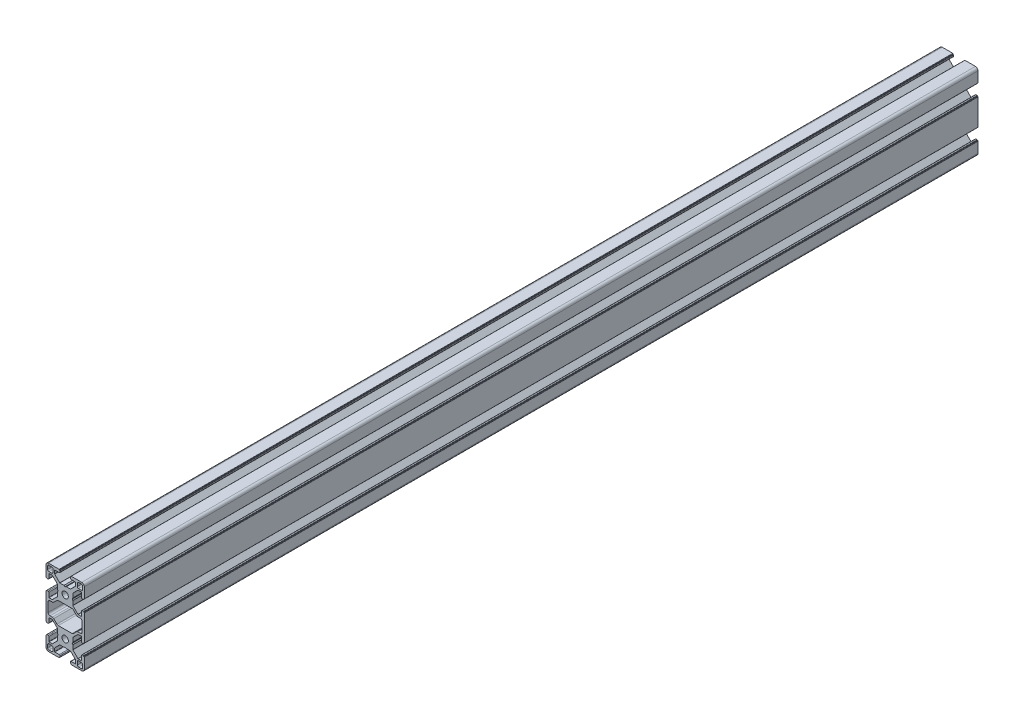
from build123d import *

# Parameters (mm, degrees)
SKETCH1_R                 = 2.45
BOSS_EXTRUDE1_DEPTH       = 700
SKETCH2_R                 = 3
CUT_EXTRUDE1_DEPTH        = 678.163200418
SKETCH3_R                 = 3
CUT_EXTRUDE2_DEPTH        = 678.827411761
M6X1_0_TAPPED_HOLE1_D     = 5
M6X1_0_TAPPED_HOLE1_DEPTH = 28
M6X1_0_TAPPED_HOLE1_TIP   = 1.502151548
M6X1_0_TAPPED_HOLE2_D     = 5
M6X1_0_TAPPED_HOLE2_DEPTH = 28
M6X1_0_TAPPED_HOLE2_TIP   = 1.502151548


with BuildPart() as part:
    # Sketch1 → Boss-Extrude1 (new body)
    with BuildSketch(Plane.XY.offset(25)):
        with BuildLine():
            Line((13.400000821, -25.95), (14.300000334, -25.95))
            ThreePointArc((14.300000334, -25.95), (14.44142169, -25.891421356), (14.500000334, -25.75))
            Line((14.500000334, -25.75), (14.500000334, -25.65))
            ThreePointArc((14.500000334, -25.65), (14.558578978, -25.508578644), (14.700000334, -25.45))
            Line((14.700000334, -25.45), (14.8, -25.45))
            ThreePointArc((14.8, -25.45), (14.941421356, -25.391421356), (15, -25.25))
            Line((15, -25.25), (15, -4.75))
            ThreePointArc((15, -4.75), (14.941421356, -4.608578644), (14.8, -4.55))
            Line((14.8, -4.55), (14.700000334, -4.55))
            ThreePointArc((14.700000334, -4.55), (14.558578978, -4.491421356), (14.500000334, -4.35))
            Line((14.500000334, -4.35), (14.500000334, -4.25))
            ThreePointArc((14.500000334, -4.25), (14.44142169, -4.108578644), (14.300000334, -4.05))
            Line((14.300000334, -4.05), (13.400000821, -4.05))
            ThreePointArc((13.400000821, -4.05), (12.975736752, -4.225735931), (12.800000821, -4.65))
            Line((12.800000821, -4.65), (12.800000821, -8.05))
            ThreePointArc((12.800000821, -8.05), (12.741422177, -8.191421356), (12.600000821, -8.25))
            Line((12.600000821, -8.25), (10.132847586, -8.25))
            ThreePointArc((10.132847586, -8.25), (10.056310912, -8.234775911), (9.991426248, -8.191421374))
            Line((9.991426248, -8.191421374), (6.06304592, -4.263042046))
            ThreePointArc((6.06304592, -4.263042046), (6.019691356, -4.19815737), (6.004467258, -4.121620672))
            Line((6.004467258, -4.121620672), (6.004467258, -0.90000009))
            Line((6.004467258, -0.90000009), (5.542586948, -0.099999736))
            ThreePointArc((5.542586948, -0.099999736), (5.515792105, 0), (5.542586948, 0.099999736))
            Line((5.542586948, 0.099999736), (6.004467258, 0.90000009))
            Line((6.004467258, 0.90000009), (6.004467258, 4.121623437))
            ThreePointArc((6.004467258, 4.121623437), (6.019691347, 4.198160112), (6.063045884, 4.263044775))
            Line((6.063045884, 4.263044775), (9.991421447, 8.191421338))
            ThreePointArc((9.991421447, 8.191421338), (10.056306123, 8.234775902), (10.132842821, 8.25))
            Line((10.132842821, 8.25), (12.600000821, 8.25))
            ThreePointArc((12.600000821, 8.25), (12.741422177, 8.191421356), (12.800000821, 8.05))
            Line((12.800000821, 8.05), (12.800000821, 4.65))
            ThreePointArc((12.800000821, 4.65), (12.975736752, 4.225735931), (13.400000821, 4.05))
            Line((13.400000821, 4.05), (14.300000334, 4.05))
            ThreePointArc((14.300000334, 4.05), (14.44142169, 4.108578644), (14.500000334, 4.25))
            Line((14.500000334, 4.25), (14.500000334, 4.350000125))
            ThreePointArc((14.500000334, 4.350000125), (14.558578978, 4.491421481), (14.700000334, 4.550000125))
            Line((14.700000334, 4.550000125), (14.8, 4.550000125))
            ThreePointArc((14.8, 4.550000125), (14.941421356, 4.608578769), (15, 4.750000125))
            Line((15, 4.750000125), (15, 13))
            ThreePointArc((15, 13), (14.414213562, 14.414213562), (13, 15))
            Line((13, 15), (4.75, 15))
            ThreePointArc((4.75, 15), (4.608578644, 14.941421356), (4.55, 14.8))
            Line((4.55, 14.8), (4.55, 14.7))
            ThreePointArc((4.55, 14.7), (4.491421356, 14.558578644), (4.35, 14.5))
            Line((4.35, 14.5), (4.25, 14.5))
            ThreePointArc((4.25, 14.5), (4.108578644, 14.441421356), (4.05, 14.3))
            Line((4.05, 14.3), (4.05, 13.4))
            ThreePointArc((4.05, 13.4), (4.225735931, 12.975735931), (4.65, 12.8))
            Line((4.65, 12.8), (8.05, 12.8))
            ThreePointArc((8.05, 12.8), (8.191421356, 12.741421356), (8.25, 12.6))
            Line((8.25, 12.6), (8.25, 10.132847492))
            ThreePointArc((8.25, 10.132847492), (8.234775904, 10.056310778), (8.191421344, 9.991426082))
            Line((8.191421344, 9.991426082), (4.258574852, 6.058578588))
            ThreePointArc((4.258574852, 6.058578588), (4.193690258, 6.015224079), (4.117153656, 6))
            Line((4.117153656, 6), (0.899999648, 6))
            Line((0.899999648, 6), (0.101934004, 5.53923672))
            ThreePointArc((0.101934004, 5.53923672), (0, 5.511923593), (-0.101934004, 5.53923672))
            Line((-0.101934004, 5.53923672), (-0.899999648, 6))
            Line((-0.899999648, 6), (-4.117156145, 6))
            ThreePointArc((-4.117156145, 6), (-4.193692724, 6.015224069), (-4.258577305, 6.058578552))
            Line((-4.258577305, 6.058578552), (-8.191421308, 9.991421554))
            ThreePointArc((-8.191421308, 9.991421554), (-8.234775894, 10.056306263), (-8.25, 10.132843))
            Line((-8.25, 10.132843), (-8.25, 12.6))
            ThreePointArc((-8.25, 12.6), (-8.191421356, 12.741421356), (-8.05, 12.8))
            Line((-8.05, 12.8), (-4.65, 12.8))
            ThreePointArc((-4.65, 12.8), (-4.225735931, 12.975735931), (-4.05, 13.4))
            Line((-4.05, 13.4), (-4.05, 14.3))
            ThreePointArc((-4.05, 14.3), (-4.108578644, 14.441421356), (-4.25, 14.5))
            Line((-4.25, 14.5), (-4.35, 14.5))
            ThreePointArc((-4.35, 14.5), (-4.491421356, 14.558578644), (-4.55, 14.7))
            Line((-4.55, 14.7), (-4.55, 14.8))
            ThreePointArc((-4.55, 14.8), (-4.608578644, 14.941421356), (-4.75, 15))
            Line((-4.75, 15), (-13, 15))
            ThreePointArc((-13, 15), (-14.414213562, 14.414213562), (-15, 13))
            Line((-15, 13), (-15, 4.750000125))
            ThreePointArc((-15, 4.750000125), (-14.941421356, 4.608578769), (-14.8, 4.550000125))
            Line((-14.8, 4.550000125), (-14.700000334, 4.550000125))
            ThreePointArc((-14.700000334, 4.550000125), (-14.558578978, 4.491421481), (-14.500000334, 4.350000125))
            Line((-14.500000334, 4.350000125), (-14.500000334, 4.25))
            ThreePointArc((-14.500000334, 4.25), (-14.44142169, 4.108578644), (-14.300000334, 4.05))
            Line((-14.300000334, 4.05), (-13.400000821, 4.05))
            ThreePointArc((-13.400000821, 4.05), (-12.975736752, 4.225735931), (-12.800000821, 4.65))
            Line((-12.800000821, 4.65), (-12.800000821, 8.05))
            ThreePointArc((-12.800000821, 8.05), (-12.741422177, 8.191421356), (-12.600000821, 8.25))
            Line((-12.600000821, 8.25), (-10.132842821, 8.25))
            ThreePointArc((-10.132842821, 8.25), (-10.056306123, 8.234775902), (-9.991421447, 8.191421338))
            Line((-9.991421447, 8.191421338), (-6.063045884, 4.263044775))
            ThreePointArc((-6.063045884, 4.263044775), (-6.019691347, 4.198160112), (-6.004467258, 4.121623437))
            Line((-6.004467258, 4.121623437), (-6.004467258, 0.90000009))
            Line((-6.004467258, 0.90000009), (-5.542586948, 0.099999736))
            ThreePointArc((-5.542586948, 0.099999736), (-5.515792105, 0), (-5.542586948, -0.099999736))
            Line((-5.542586948, -0.099999736), (-6.004467258, -0.90000009))
            Line((-6.004467258, -0.90000009), (-6.004467258, -4.121623437))
            ThreePointArc((-6.004467258, -4.121623437), (-6.019691347, -4.198160112), (-6.063045884, -4.263044775))
            Line((-6.063045884, -4.263044775), (-9.991421447, -8.191421338))
            ThreePointArc((-9.991421447, -8.191421338), (-10.056306123, -8.234775902), (-10.132842821, -8.25))
            Line((-10.132842821, -8.25), (-12.600000821, -8.25))
            ThreePointArc((-12.600000821, -8.25), (-12.741422177, -8.191421356), (-12.800000821, -8.05))
            Line((-12.800000821, -8.05), (-12.800000821, -4.65))
            ThreePointArc((-12.800000821, -4.65), (-12.975736752, -4.225735931), (-13.400000821, -4.05))
            Line((-13.400000821, -4.05), (-14.300000334, -4.05))
            ThreePointArc((-14.300000334, -4.05), (-14.44142169, -4.108578644), (-14.500000334, -4.25))
            Line((-14.500000334, -4.25), (-14.500000334, -4.35))
            ThreePointArc((-14.500000334, -4.35), (-14.558578978, -4.491421356), (-14.700000334, -4.55))
            Line((-14.700000334, -4.55), (-14.8, -4.55))
            ThreePointArc((-14.8, -4.55), (-14.941421356, -4.608578644), (-15, -4.75))
            Line((-15, -4.75), (-15, -25.25))
            ThreePointArc((-15, -25.25), (-14.941421356, -25.391421356), (-14.8, -25.45))
            Line((-14.8, -25.45), (-14.700000334, -25.45))
            ThreePointArc((-14.700000334, -25.45), (-14.558578978, -25.508578644), (-14.500000334, -25.65))
            Line((-14.500000334, -25.65), (-14.500000334, -25.75))
            ThreePointArc((-14.500000334, -25.75), (-14.44142169, -25.891421356), (-14.300000334, -25.95))
            Line((-14.300000334, -25.95), (-13.400000821, -25.95))
            ThreePointArc((-13.400000821, -25.95), (-12.975736752, -25.774264069), (-12.800000821, -25.35))
            Line((-12.800000821, -25.35), (-12.800000821, -21.95))
            ThreePointArc((-12.800000821, -21.95), (-12.741422177, -21.808578644), (-12.600000821, -21.75))
            Line((-12.600000821, -21.75), (-10.132842821, -21.75))
            ThreePointArc((-10.132842821, -21.75), (-10.056306123, -21.765224098), (-9.991421447, -21.808578662))
            Line((-9.991421447, -21.808578662), (-6.063045884, -25.736955225))
            ThreePointArc((-6.063045884, -25.736955225), (-6.019691347, -25.801839888), (-6.004467258, -25.878376563))
            Line((-6.004467258, -25.878376563), (-6.004467258, -29.09999991))
            Line((-6.004467258, -29.09999991), (-5.542586948, -29.900000264))
            ThreePointArc((-5.542586948, -29.900000264), (-5.515792105, -30), (-5.542586948, -30.099999736))
            Line((-5.542586948, -30.099999736), (-6.004467258, -30.90000009))
            Line((-6.004467258, -30.90000009), (-6.004467258, -34.121623437))
            ThreePointArc((-6.004467258, -34.121623437), (-6.019691347, -34.198160112), (-6.063045884, -34.263044775))
            Line((-6.063045884, -34.263044775), (-9.991421447, -38.191421338))
            ThreePointArc((-9.991421447, -38.191421338), (-10.056306123, -38.234775902), (-10.132842821, -38.25))
            Line((-10.132842821, -38.25), (-12.600000821, -38.25))
            ThreePointArc((-12.600000821, -38.25), (-12.741422177, -38.191421356), (-12.800000821, -38.05))
            Line((-12.800000821, -38.05), (-12.800000821, -34.65))
            ThreePointArc((-12.800000821, -34.65), (-12.975736752, -34.225735931), (-13.400000821, -34.05))
            Line((-13.400000821, -34.05), (-14.300000334, -34.05))
            ThreePointArc((-14.300000334, -34.05), (-14.44142169, -34.108578644), (-14.500000334, -34.25))
            Line((-14.500000334, -34.25), (-14.500000334, -34.350000125))
            ThreePointArc((-14.500000334, -34.350000125), (-14.558578978, -34.491421481), (-14.700000334, -34.550000125))
            Line((-14.700000334, -34.550000125), (-14.8, -34.550000125))
            ThreePointArc((-14.8, -34.550000125), (-14.941421356, -34.608578769), (-15, -34.750000125))
            Line((-15, -34.750000125), (-15, -43))
            ThreePointArc((-15, -43), (-14.414213562, -44.414213562), (-13, -45))
            Line((-13, -45), (-4.75, -45))
            ThreePointArc((-4.75, -45), (-4.608578644, -44.941421356), (-4.55, -44.8))
            Line((-4.55, -44.8), (-4.55, -44.7))
            ThreePointArc((-4.55, -44.7), (-4.491421356, -44.558578644), (-4.35, -44.5))
            Line((-4.35, -44.5), (-4.25, -44.5))
            ThreePointArc((-4.25, -44.5), (-4.108578644, -44.441421356), (-4.05, -44.3))
            Line((-4.05, -44.3), (-4.05, -43.4))
            ThreePointArc((-4.05, -43.4), (-4.225735931, -42.975735931), (-4.65, -42.8))
            Line((-4.65, -42.8), (-8.05, -42.8))
            ThreePointArc((-8.05, -42.8), (-8.191421356, -42.741421356), (-8.25, -42.6))
            Line((-8.25, -42.6), (-8.25, -40.132843))
            ThreePointArc((-8.25, -40.132843), (-8.234775894, -40.056306263), (-8.191421308, -39.991421554))
            Line((-8.191421308, -39.991421554), (-4.258577305, -36.058578552))
            ThreePointArc((-4.258577305, -36.058578552), (-4.193692724, -36.015224069), (-4.117156145, -36))
            Line((-4.117156145, -36), (-0.899999648, -36))
            Line((-0.899999648, -36), (-0.101934004, -35.53923672))
            ThreePointArc((-0.101934004, -35.53923672), (0, -35.511923593), (0.101934004, -35.53923672))
            Line((0.101934004, -35.53923672), (0.899999648, -36))
            Line((0.899999648, -36), (4.117153656, -36))
            ThreePointArc((4.117153656, -36), (4.193690258, -36.015224079), (4.258574852, -36.058578588))
            Line((4.258574852, -36.058578588), (8.191421344, -39.991426082))
            ThreePointArc((8.191421344, -39.991426082), (8.234775904, -40.056310778), (8.25, -40.132847492))
            Line((8.25, -40.132847492), (8.25, -42.6))
            ThreePointArc((8.25, -42.6), (8.191421356, -42.741421356), (8.05, -42.8))
            Line((8.05, -42.8), (4.65, -42.8))
            ThreePointArc((4.65, -42.8), (4.225735931, -42.975735931), (4.05, -43.4))
            Line((4.05, -43.4), (4.05, -44.3))
            ThreePointArc((4.05, -44.3), (4.108578644, -44.441421356), (4.25, -44.5))
            Line((4.25, -44.5), (4.35, -44.5))
            ThreePointArc((4.35, -44.5), (4.491421356, -44.558578644), (4.55, -44.7))
            Line((4.55, -44.7), (4.55, -44.8))
            ThreePointArc((4.55, -44.8), (4.608578644, -44.941421356), (4.75, -45))
            Line((4.75, -45), (13, -45))
            ThreePointArc((13, -45), (14.414213562, -44.414213562), (15, -43))
            Line((15, -43), (15, -34.750000125))
            ThreePointArc((15, -34.750000125), (14.941421356, -34.608578769), (14.8, -34.550000125))
            Line((14.8, -34.550000125), (14.700000334, -34.550000125))
            ThreePointArc((14.700000334, -34.550000125), (14.558578978, -34.491421481), (14.500000334, -34.350000125))
            Line((14.500000334, -34.350000125), (14.500000334, -34.25))
            ThreePointArc((14.500000334, -34.25), (14.44142169, -34.108578644), (14.300000334, -34.05))
            Line((14.300000334, -34.05), (13.400000821, -34.05))
            ThreePointArc((13.400000821, -34.05), (12.975736752, -34.225735931), (12.800000821, -34.65))
            Line((12.800000821, -34.65), (12.800000821, -38.05))
            ThreePointArc((12.800000821, -38.05), (12.741422177, -38.191421356), (12.600000821, -38.25))
            Line((12.600000821, -38.25), (10.132842821, -38.25))
            ThreePointArc((10.132842821, -38.25), (10.056306123, -38.234775902), (9.991421447, -38.191421338))
            Line((9.991421447, -38.191421338), (6.063045884, -34.263044775))
            ThreePointArc((6.063045884, -34.263044775), (6.019691347, -34.198160112), (6.004467258, -34.121623437))
            Line((6.004467258, -34.121623437), (6.004467258, -30.90000009))
            Line((6.004467258, -30.90000009), (5.542586948, -30.099999736))
            ThreePointArc((5.542586948, -30.099999736), (5.515792105, -30), (5.542586948, -29.900000264))
            Line((5.542586948, -29.900000264), (6.004467258, -29.09999991))
            Line((6.004467258, -29.09999991), (6.004467258, -25.878379328))
            ThreePointArc((6.004467258, -25.878379328), (6.019691356, -25.80184263), (6.06304592, -25.736957954))
            Line((6.06304592, -25.736957954), (9.991426248, -21.808578626))
            ThreePointArc((9.991426248, -21.808578626), (10.056310912, -21.765224089), (10.132847586, -21.75))
            Line((10.132847586, -21.75), (12.600000821, -21.75))
            ThreePointArc((12.600000821, -21.75), (12.741422177, -21.808578644), (12.800000821, -21.95))
            Line((12.800000821, -21.95), (12.800000821, -25.35))
            ThreePointArc((12.800000821, -25.35), (12.975736752, -25.774264069), (13.400000821, -25.95))
        make_face()
        Circle(SKETCH1_R, mode=Mode.SUBTRACT)
        with Locations((0, -30)):
            Circle(SKETCH1_R, mode=Mode.SUBTRACT)
        with BuildLine():
            Line((-9.500000904, 12.700000174), (-9.500000904, 10.500000174))
            ThreePointArc((-9.500000904, 10.500000174), (-9.792894123, 9.792893393), (-10.500000904, 9.500000174))
            Line((-10.500000904, 9.500000174), (-12.700000904, 9.500000174))
            ThreePointArc((-12.700000904, 9.500000174), (-13.407107685, 9.792893393), (-13.700000904, 10.500000174))
            Line((-13.700000904, 10.500000174), (-13.700000904, 12.700000174))
            ThreePointArc((-13.700000904, 12.700000174), (-13.407107685, 13.407106955), (-12.700000904, 13.700000174))
            Line((-12.700000904, 13.700000174), (-10.500000904, 13.700000174))
            ThreePointArc((-10.500000904, 13.700000174), (-9.792894123, 13.407106955), (-9.500000904, 12.700000174))
        make_face(mode=Mode.SUBTRACT)
        with BuildLine():
            Line((12.700000904, 9.500000174), (10.500000904, 9.500000174))
            ThreePointArc((10.500000904, 9.500000174), (9.792894123, 9.792893393), (9.500000904, 10.500000174))
            Line((9.500000904, 10.500000174), (9.500000904, 12.700000174))
            ThreePointArc((9.500000904, 12.700000174), (9.792894123, 13.407106955), (10.500000904, 13.700000174))
            Line((10.500000904, 13.700000174), (12.700000904, 13.700000174))
            ThreePointArc((12.700000904, 13.700000174), (13.407107685, 13.407106955), (13.700000904, 12.700000174))
            Line((13.700000904, 12.700000174), (13.700000904, 10.500000174))
            ThreePointArc((13.700000904, 10.500000174), (13.407107685, 9.792893393), (12.700000904, 9.500000174))
        make_face(mode=Mode.SUBTRACT)
        with BuildLine():
            Line((-12.700000904, -39.500000174), (-10.500000904, -39.500000174))
            ThreePointArc((-10.500000904, -39.500000174), (-9.792894123, -39.792893393), (-9.500000904, -40.500000174))
            Line((-9.500000904, -40.500000174), (-9.500000904, -42.700000174))
            ThreePointArc((-9.500000904, -42.700000174), (-9.792894123, -43.407106955), (-10.500000904, -43.700000174))
            Line((-10.500000904, -43.700000174), (-12.700000904, -43.700000174))
            ThreePointArc((-12.700000904, -43.700000174), (-13.407107685, -43.407106955), (-13.700000904, -42.700000174))
            Line((-13.700000904, -42.700000174), (-13.700000904, -40.500000174))
            ThreePointArc((-13.700000904, -40.500000174), (-13.407107685, -39.792893393), (-12.700000904, -39.500000174))
        make_face(mode=Mode.SUBTRACT)
        with BuildLine():
            Line((9.500000904, -42.700000174), (9.500000904, -40.500000174))
            ThreePointArc((9.500000904, -40.500000174), (9.792894123, -39.792893393), (10.500000904, -39.500000174))
            Line((10.500000904, -39.500000174), (12.700000904, -39.500000174))
            ThreePointArc((12.700000904, -39.500000174), (13.407107685, -39.792893393), (13.700000904, -40.500000174))
            Line((13.700000904, -40.500000174), (13.700000904, -42.700000174))
            ThreePointArc((13.700000904, -42.700000174), (13.407107685, -43.407106955), (12.700000904, -43.700000174))
            Line((12.700000904, -43.700000174), (10.500000904, -43.700000174))
            ThreePointArc((10.500000904, -43.700000174), (9.792894123, -43.407106955), (9.500000904, -42.700000174))
        make_face(mode=Mode.SUBTRACT)
        with BuildLine():
            Line((8.927207746, -20.539339865), (6.410354062, -23.056193892))
            ThreePointArc((6.410354062, -23.056193892), (5.923719014, -23.381353072), (5.349693818, -23.495533793))
            Line((5.349693818, -23.495533793), (-5.349693818, -23.495533793))
            ThreePointArc((-5.349693818, -23.495533793), (-5.923719014, -23.381353072), (-6.410354062, -23.056193892))
            Line((-6.410354062, -23.056193892), (-8.927207746, -20.539339865))
            ThreePointArc((-8.927207746, -20.539339865), (-9.413842755, -20.214180712), (-9.987867904, -20.1))
            Line((-9.987867904, -20.1), (-11.849999904, -20.1))
            ThreePointArc((-11.849999904, -20.1), (-12.910660076, -19.660660172), (-13.349999904, -18.6))
            Line((-13.349999904, -18.6), (-13.349999904, -11.4))
            ThreePointArc((-13.349999904, -11.4), (-12.910660076, -10.339339828), (-11.849999904, -9.9))
            Line((-11.849999904, -9.9), (-9.987867904, -9.9))
            ThreePointArc((-9.987867904, -9.9), (-9.413842755, -9.785819288), (-8.927207746, -9.460660135))
            Line((-8.927207746, -9.460660135), (-6.410354062, -6.943806108))
            ThreePointArc((-6.410354062, -6.943806108), (-5.923719014, -6.618646928), (-5.349693818, -6.504466207))
            Line((-5.349693818, -6.504466207), (5.349693818, -6.504466207))
            ThreePointArc((5.349693818, -6.504466207), (5.923719014, -6.618646928), (6.410354062, -6.943806108))
            Line((6.410354062, -6.943806108), (8.927207746, -9.460660135))
            ThreePointArc((8.927207746, -9.460660135), (9.413842755, -9.785819288), (9.987867904, -9.9))
            Line((9.987867904, -9.9), (11.849999904, -9.9))
            ThreePointArc((11.849999904, -9.9), (12.910660076, -10.339339828), (13.349999904, -11.4))
            Line((13.349999904, -11.4), (13.349999904, -18.6))
            ThreePointArc((13.349999904, -18.6), (12.910660076, -19.660660172), (11.849999904, -20.1))
            Line((11.849999904, -20.1), (9.987867904, -20.1))
            ThreePointArc((9.987867904, -20.1), (9.413842755, -20.214180712), (8.927207746, -20.539339865))
        make_face(mode=Mode.SUBTRACT)
    extrude(amount=-BOSS_EXTRUDE1_DEPTH)

    # Sketch2 → Cut-Extrude1 (cut, through all)
    with BuildSketch(Plane(origin=(15, 0, 0), x_dir=(0, 0, -1), z_dir=(1, 0, 0))):
        with Locations((20, -30)):
            Circle(SKETCH2_R)
        with Locations((20, 0)):
            Circle(SKETCH2_R)
        with Locations((660, 0)):
            Circle(SKETCH2_R)
        with Locations((660, -30)):
            Circle(SKETCH2_R)
    extrude(amount=-CUT_EXTRUDE1_DEPTH, mode=Mode.SUBTRACT)

    # Sketch3 → Cut-Extrude2 (cut, through all)
    with BuildSketch(Plane.XZ.offset(45)):
        with Locations((0, -20)):
            Circle(SKETCH3_R)
        with Locations((0, -660)):
            Circle(SKETCH3_R)
    extrude(amount=-CUT_EXTRUDE2_DEPTH, mode=Mode.SUBTRACT)

    # M6x1.0 Tapped Hole1
    with Locations(Plane.XY.offset(25)):
        with Locations((0, 0), (0, -30)):
            Hole(M6X1_0_TAPPED_HOLE1_D / 2, depth=M6X1_0_TAPPED_HOLE1_DEPTH)
            with Locations((0, 0, -(M6X1_0_TAPPED_HOLE1_DEPTH + M6X1_0_TAPPED_HOLE1_TIP / 2))):  # 118° drill point
                Cone(0, M6X1_0_TAPPED_HOLE1_D / 2, M6X1_0_TAPPED_HOLE1_TIP, mode=Mode.SUBTRACT)

    # M6x1.0 Tapped Hole2
    with Locations(Plane(origin=(0, 0, -675), x_dir=(-1, 0, 0), z_dir=(0, 0, -1))):
        with Locations((0, 0), (0, -30)):
            Hole(M6X1_0_TAPPED_HOLE2_D / 2, depth=M6X1_0_TAPPED_HOLE2_DEPTH)
            with Locations((0, 0, -(M6X1_0_TAPPED_HOLE2_DEPTH + M6X1_0_TAPPED_HOLE2_TIP / 2))):  # 118° drill point
                Cone(0, M6X1_0_TAPPED_HOLE2_D / 2, M6X1_0_TAPPED_HOLE2_TIP, mode=Mode.SUBTRACT)


solid = part.part
